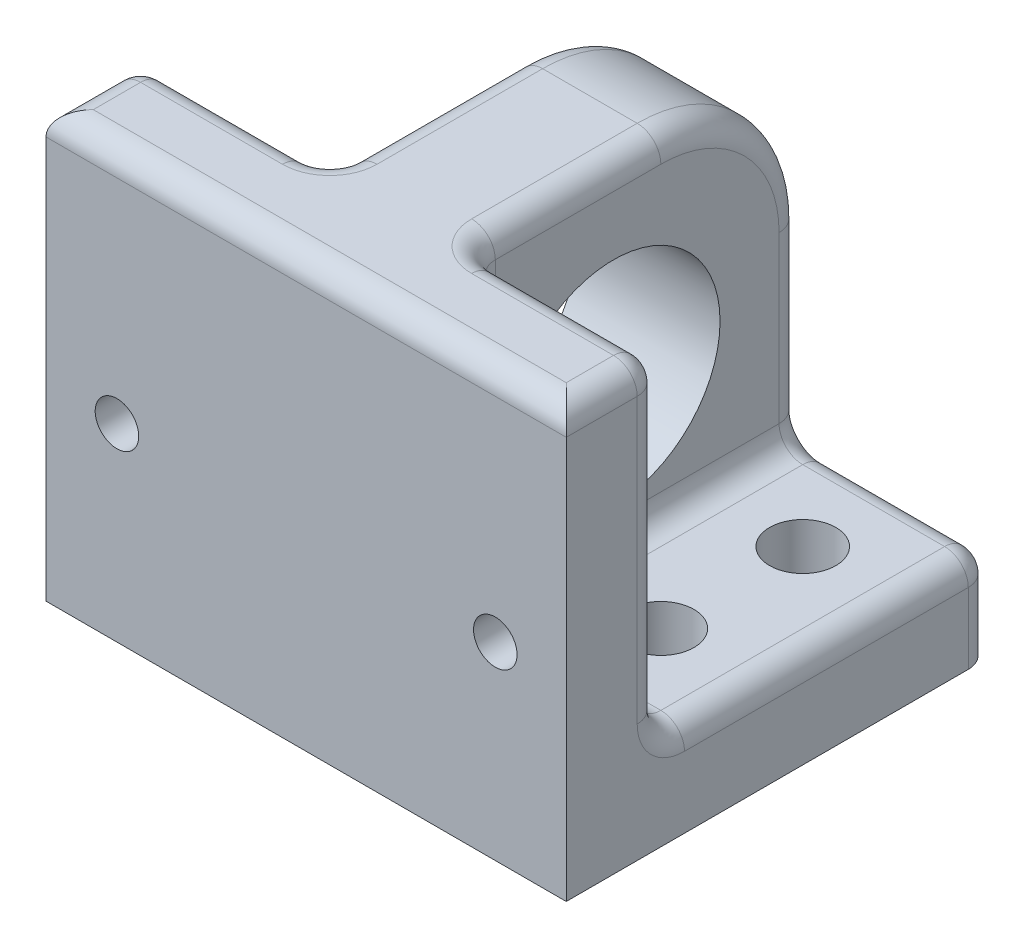
from build123d import *

# Parameters (mm, degrees)
SKETCH1_R           = 14.3002
BOSS_EXTRUDE1_DEPTH = 69.85
SKETCH2_W           = 25.4
SKETCH2_H           = 44.45
CUT_EXTRUDE1_DEPTH  = 44.45
FILLET1_R           = 3.175
SKETCH3_R           = 2.921
CUT_EXTRUDE2_DEPTH  = 107.823534499
SKETCH4_R           = 2.921
CUT_EXTRUDE3_DEPTH  = 107.823534499
SKETCH5_R           = 4.445
CUT_EXTRUDE4_DEPTH  = 6.35
CUT_EXTRUDE5_DEPTH  = 7.62


with BuildPart() as part:
    # Sketch1 → Boss-Extrude1 (new body)
    with BuildSketch(Plane(origin=(0, 0, 0), x_dir=(0, 0, -1), z_dir=(1, 0, 0))):
        with BuildLine():
            Line((0, 0), (57.15, 0))
            Line((57.15, 0), (57.15, 38.1))
            ThreePointArc((57.15, 38.1), (51.570384182, 51.570384182), (38.1, 57.15))
            Line((38.1, 57.15), (0, 57.15))
            Line((0, 57.15), (0, 0))
        make_face()
        with Locations((31.75, 31.75)):
            Circle(SKETCH1_R, mode=Mode.SUBTRACT)
    extrude(amount=BOSS_EXTRUDE1_DEPTH)

    # Sketch2 → Cut-Extrude1 (cut)
    with BuildSketch(Plane(origin=(0, 57.15, 0), x_dir=(1, 0, 0), z_dir=(0, 1, 0))):
        with Locations((12.7, 34.925)):
            Rectangle(SKETCH2_W, SKETCH2_H)
        with Locations((57.15, 34.925)):
            Rectangle(SKETCH2_W, SKETCH2_H)
    extrude(amount=-CUT_EXTRUDE1_DEPTH, mode=Mode.SUBTRACT)

    # Fillet1
    fillet1_edges = [part.edges().sort_by_distance(p)[0] for p in [
        (12.7, 57.15, -12.7),
        (57.15, 57.15, -12.7),
        (25.4, 57.15, -25.4),
        (44.45, 57.15, -25.4),
        (25.4, 51.570384182, -51.570384182),
        (44.45, 51.570384182, -51.570384182),
        (0, 34.925, -12.7),
        (25.4, 25.4, -57.15),
        (69.85, 34.925, -12.7),
        (44.45, 25.4, -57.15),
        (0, 12.7, -34.925),
        (12.7, 12.7, -12.7),
        (25.4, 34.925, -12.7),
        (25.4, 12.7, -34.925),
        (12.7, 12.7, -57.15),
        (69.85, 12.7, -34.925),
        (57.15, 12.7, -57.15),
        (0, 6.35, -57.15),
        (69.85, 6.35, -57.15),
        (44.45, 12.7, -34.925),
        (57.15, 12.7, -12.7),
        (44.45, 34.925, -12.7),
        (0, 57.15, -6.35),
        (69.85, 57.15, -6.35),
        (34.925, 57.15, 0),
    ]]
    fillet(fillet1_edges, radius=FILLET1_R)

    # Sketch3 → Cut-Extrude2 (cut, through all)
    with BuildSketch(Plane.XY):
        with Locations((9.525, 25.4)):
            Circle(SKETCH3_R)
        with Locations((60.325, 25.4)):
            Circle(SKETCH3_R)
    extrude(amount=-CUT_EXTRUDE2_DEPTH, mode=Mode.SUBTRACT)

    # Sketch4 → Cut-Extrude3 (cut, through all)
    with BuildSketch(Plane.XZ):
        with Locations((57.15, -25.4)):
            Circle(SKETCH4_R)
        with Locations((57.15, -44.45)):
            Circle(SKETCH4_R)
        with Locations((12.7, -25.4)):
            Circle(SKETCH4_R)
        with Locations((12.7, -44.45)):
            Circle(SKETCH4_R)
    extrude(amount=-CUT_EXTRUDE3_DEPTH, mode=Mode.SUBTRACT)

    # Sketch5 → Cut-Extrude4 (cut)
    with BuildSketch(Plane(origin=(0, 12.7, 0), x_dir=(1, 0, 0), z_dir=(0, 1, 0))):
        with Locations((12.7, 25.4)):
            Circle(SKETCH5_R)
        with Locations((12.7, 44.45)):
            Circle(SKETCH5_R)
        with Locations((57.15, 44.45)):
            Circle(SKETCH5_R)
        with Locations((57.15, 25.4)):
            Circle(SKETCH5_R)
    extrude(amount=-CUT_EXTRUDE4_DEPTH, mode=Mode.SUBTRACT)

    # Sketch6 → Cut-Extrude5 (cut)
    with BuildSketch(Plane(origin=(0, 0, -12.7), x_dir=(-1, 0, 0), z_dir=(0, 0, -1))):
        Polygon((-57.392060633, 30.48), (-63.257939367, 30.48), (-66.190878735, 25.4), (-63.257939367, 20.32), (-57.392060633, 20.32), (-54.459121265, 25.4), align=None)
        Polygon((-6.592060633, 30.48), (-12.457939367, 30.48), (-15.390878735, 25.4), (-12.457939367, 20.32), (-6.592060633, 20.32), (-3.659121265, 25.4), align=None)
    extrude(amount=-CUT_EXTRUDE5_DEPTH, mode=Mode.SUBTRACT)


solid = part.part
